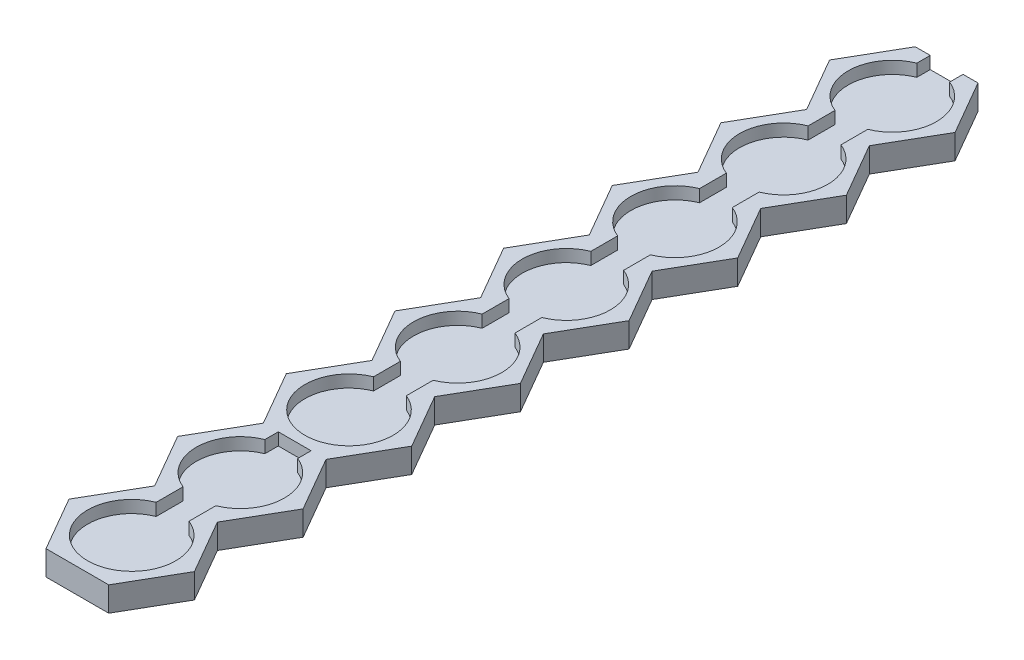
from build123d import *

# Parameters (mm, degrees)
BOSS_EXTRUDE1_DEPTH = 6
SKETCH2_R           = 10.75
CUT_EXTRUDE1_DEPTH  = 3
SKETCH4_W           = 8
SKETCH4_H           = 3.271898978
CUT_EXTRUDE2_DEPTH  = 3
LPATTERN1_COUNT     = 2
LPATTERN1_PITCH     = 26.5
SKETCH6_W           = 8
SKETCH6_H           = 3
CUT_EXTRUDE3_DEPTH  = 32.182259914
LPATTERN2_START     = -6
LPATTERN2_DEPTH     = 3
LPATTERN2_START_2   = -3
LPATTERN2_2_DEPTH   = 3


# Read off the part's stored shape, not the designer's step: LPattern2
with BuildPart() as part:
    # Sketch3 → Boss-Extrude1 (new body)
    with BuildSketch(Plane(origin=(0, 0, 0), x_dir=(1, 0, 0), z_dir=(0, 1, 0))):
        Polygon((15.299782134, 0), (7.649891067, 13.25), (-7.649891067, 13.25), (-15.299782134, 0), (-7.649891067, -13.25), (7.649891067, -13.25), align=None)
    boss_extrude1 = extrude(amount=-BOSS_EXTRUDE1_DEPTH)

    # Sketch2 → Cut-Extrude1 (cut)
    with BuildSketch(Plane(origin=(0, 0, 0), x_dir=(1, 0, 0), z_dir=(0, 1, 0))):
        with Locations(Location((0, 0, 0), (0, 0, 270))):
            Circle(SKETCH2_R)
    cut_extrude1 = extrude(amount=-CUT_EXTRUDE1_DEPTH, mode=Mode.SUBTRACT)

    # Sketch4 → Cut-Extrude2 (cut)
    with BuildSketch(Plane(origin=(0, 0, 0), x_dir=(1, 0, 0), z_dir=(0, 1, 0))):
        with Locations((0, 11.614050511)):
            Rectangle(SKETCH4_W, SKETCH4_H)
    cut_extrude2 = extrude(amount=-CUT_EXTRUDE2_DEPTH, mode=Mode.SUBTRACT)

    # LPattern1: Boss-Extrude1, Cut-Extrude1, Cut-Extrude2 ×2
    with Locations(*[(0, 0, -i * LPATTERN1_PITCH) for i in range(1, LPATTERN1_COUNT)]):
        add(boss_extrude1)
        add(cut_extrude1, mode=Mode.SUBTRACT)
        add(cut_extrude2, mode=Mode.SUBTRACT)

    # Sketch6 → Cut-Extrude3 (cut, through all)
    with BuildSketch(Plane.XY.offset(-13.25)):
        with Locations((0, -1.5)):
            Rectangle(SKETCH6_W, SKETCH6_H)
    extrude(amount=-CUT_EXTRUDE3_DEPTH, mode=Mode.SUBTRACT)

    # LPattern2 outline → LPattern2 (add)
    with BuildSketch(Plane(origin=(0, 0, 0), x_dir=(1, 0, 0), z_dir=(0, 1, 0)).offset(LPATTERN2_START)):
        Polygon((-7.649891067, 198.75), (-15.299782134, 185.5), (-7.649891067, 172.25), (-15.299782134, 159), (-7.649891067, 145.75), (-15.299782134, 132.5), (-7.649891067, 119.25), (-15.299782134, 106), (-7.649891067, 92.75), (-15.299782134, 79.5), (-7.649891067, 66.25), (-15.299782134, 53), (-7.649891067, 39.75), (7.649891067, 39.75), (15.299782134, 53), (7.649891067, 66.25), (15.299782134, 79.5), (7.649891067, 92.75), (15.299782134, 106), (7.649891067, 119.25), (15.299782134, 132.5), (7.649891067, 145.75), (15.299782134, 159), (7.649891067, 172.25), (15.299782134, 185.5), (7.649891067, 198.75), align=None)
    extrude(amount=LPATTERN2_DEPTH)

    # LPattern2 2 outline → LPattern2 2 (add)
    with BuildSketch(Plane(origin=(0, 0, 0), x_dir=(1, 0, 0), z_dir=(0, 1, 0)).offset(LPATTERN2_START_2)):
        with BuildLine():
            ThreePointArc((-4, 69.521898978), (-10.75, 79.5), (-4, 89.478101022))
            Line((-4, 89.478101022), (-4, 96.021898978))
            ThreePointArc((-4, 96.021898978), (-10.75, 106), (-4, 115.978101022))
            Line((-4, 115.978101022), (-4, 122.521898978))
            ThreePointArc((-4, 122.521898978), (-10.75, 132.5), (-4, 142.478101022))
            Line((-4, 142.478101022), (-4, 149.021898978))
            ThreePointArc((-4, 149.021898978), (-10.75, 159), (-4, 168.978101022))
            Line((-4, 168.978101022), (-4, 175.521898978))
            ThreePointArc((-4, 175.521898978), (-10.75, 185.5), (-4, 195.478101022))
            Line((-4, 195.478101022), (-4, 198.75))
            Line((-4, 198.75), (-7.649891067, 198.75))
            Line((-7.649891067, 198.75), (-15.299782134, 185.5))
            Line((-15.299782134, 185.5), (-7.649891067, 172.25))
            Line((-7.649891067, 172.25), (-15.299782134, 159))
            Line((-15.299782134, 159), (-7.649891067, 145.75))
            Line((-7.649891067, 145.75), (-15.299782134, 132.5))
            Line((-15.299782134, 132.5), (-7.649891067, 119.25))
            Line((-7.649891067, 119.25), (-15.299782134, 106))
            Line((-15.299782134, 106), (-7.649891067, 92.75))
            Line((-7.649891067, 92.75), (-15.299782134, 79.5))
            Line((-15.299782134, 79.5), (-7.649891067, 66.25))
            Line((-7.649891067, 66.25), (-15.299782134, 53))
            Line((-15.299782134, 53), (-7.649891067, 39.75))
            Line((-7.649891067, 39.75), (7.649891067, 39.75))
            Line((7.649891067, 39.75), (15.299782134, 53))
            Line((15.299782134, 53), (7.649891067, 66.25))
            Line((7.649891067, 66.25), (15.299782134, 79.5))
            Line((15.299782134, 79.5), (7.649891067, 92.75))
            Line((7.649891067, 92.75), (15.299782134, 106))
            Line((15.299782134, 106), (7.649891067, 119.25))
            Line((7.649891067, 119.25), (15.299782134, 132.5))
            Line((15.299782134, 132.5), (7.649891067, 145.75))
            Line((7.649891067, 145.75), (15.299782134, 159))
            Line((15.299782134, 159), (7.649891067, 172.25))
            Line((7.649891067, 172.25), (15.299782134, 185.5))
            Line((15.299782134, 185.5), (7.649891067, 198.75))
            Line((7.649891067, 198.75), (4, 198.75))
            Line((4, 198.75), (4, 195.478101022))
            ThreePointArc((4, 195.478101022), (10.75, 185.5), (4, 175.521898978))
            Line((4, 175.521898978), (4, 168.978101022))
            ThreePointArc((4, 168.978101022), (10.75, 159), (4, 149.021898978))
            Line((4, 149.021898978), (4, 142.478101022))
            ThreePointArc((4, 142.478101022), (10.75, 132.5), (4, 122.521898978))
            Line((4, 122.521898978), (4, 115.978101022))
            ThreePointArc((4, 115.978101022), (10.75, 106), (4, 96.021898978))
            Line((4, 96.021898978), (4, 89.478101022))
            ThreePointArc((4, 89.478101022), (10.75, 79.5), (4, 69.521898978))
            Line((4, 69.521898978), (4, 62.978101022))
            ThreePointArc((4, 62.978101022), (0, 42.25), (-4, 62.978101022))
            Line((-4, 62.978101022), (-4, 69.521898978))
        make_face()
    extrude(amount=LPATTERN2_2_DEPTH)


solid = part.part
